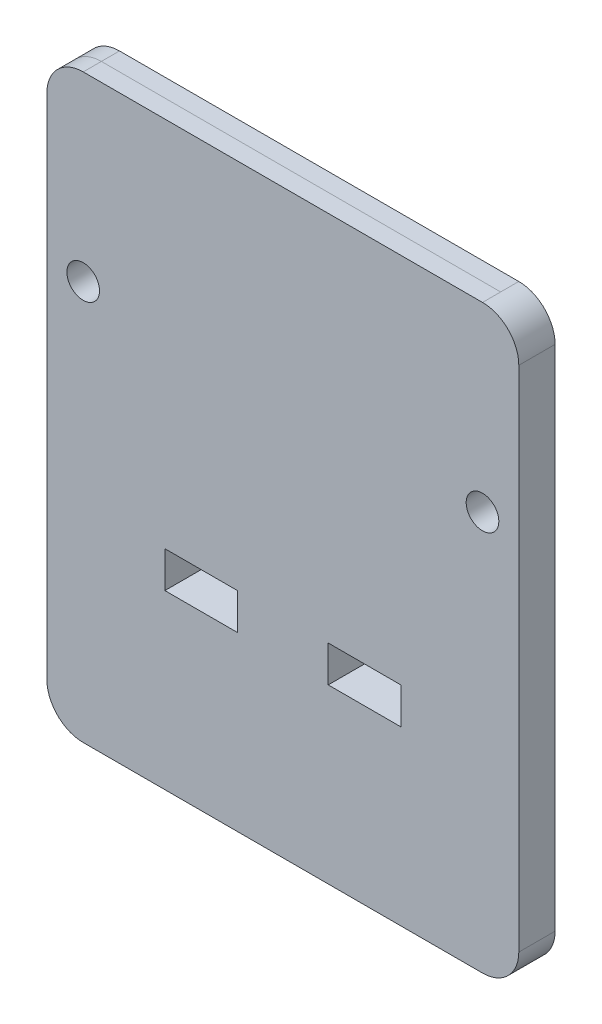
from build123d import *

# Parameters (mm, degrees)
SKETCH1_R                      = 11.422
BOSS_EXTRUDE1_DEPTH            = 25.4
SKETCH2_W                      = 50.8
SKETCH2_H                      = 25.4
FOAM_INSERT_CUT_THROUGHS_DEPTH = 25.4


with BuildPart() as part:
    # Sketch1 → Boss-Extrude1 (new body)
    with BuildSketch(Plane.XY):
        with BuildLine():
            Line((-139.7, -203.2), (139.7, -203.2))
            ThreePointArc((139.7, -203.2), (157.660512242, -195.760512242), (165.1, -177.8))
            Line((165.1, -177.8), (165.1, 177.8))
            ThreePointArc((165.1, 177.8), (157.660512242, 195.760512242), (139.7, 203.2))
            Line((139.7, 203.2), (-139.7, 203.2))
            ThreePointArc((-139.7, 203.2), (-157.660512242, 195.760512242), (-165.1, 177.8))
            Line((-165.1, 177.8), (-165.1, -177.8))
            ThreePointArc((-165.1, -177.8), (-157.660512242, -195.760512242), (-139.7, -203.2))
        make_face()
        with Locations((-139.7, 76.2)):
            Circle(SKETCH1_R, mode=Mode.SUBTRACT)
        with Locations((139.7, 76.2)):
            Circle(SKETCH1_R, mode=Mode.SUBTRACT)
    extrude(amount=BOSS_EXTRUDE1_DEPTH)

    # Sketch2 → Foam Insert Cut-Throughs (cut)
    with BuildSketch(Plane(origin=(0, 0, 0), x_dir=(-1, 0, 0), z_dir=(0, 0, -1))):
        with Locations((-57.15, -69.85)):
            Rectangle(SKETCH2_W, SKETCH2_H)
        with Locations((57.15, -69.85)):
            Rectangle(SKETCH2_W, SKETCH2_H)
    extrude(amount=-FOAM_INSERT_CUT_THROUGHS_DEPTH, mode=Mode.SUBTRACT)


solid = part.part
